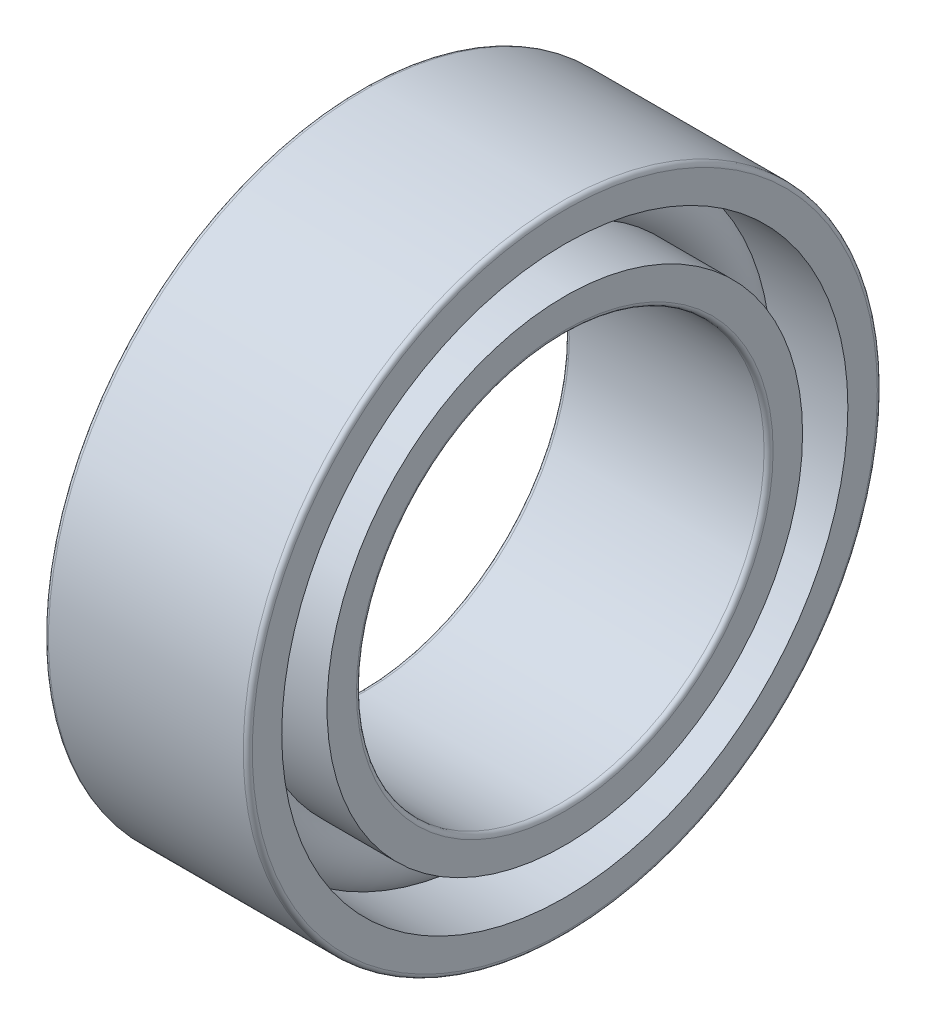
from build123d import *

# Parameters (mm, degrees)
CAGSPISKE_W     = 0.15
CAGSPISKE_H     = 0.25
CAGESPINE_ANGLE = 0.001
BALSIMSKE_R     = 0.75


with BuildPart() as part:
    # CagSpiSke → CageSpine (revolve)
    with BuildSketch(Plane.XY):
        with Locations((0, 5.75)):
            Rectangle(CAGSPISKE_W, CAGSPISKE_H)
    revolve(axis=Axis((-20.6375, 0, 0), (-1, 0, 0)), revolution_arc=CAGESPINE_ANGLE)

    # BalSimSke → BallsSimplified (revolve)
    with BuildSketch(Plane.XY):
        with Locations((0, 5.75)):
            Circle(BALSIMSKE_R)
    revolve(axis=Axis((-10, 0, 0), (1, 0, 0)))

    # InnRacSke → InnerRace (revolve)
    with BuildSketch(Plane.XY):
        with BuildLine():
            Line((-0.525, 5.25), (-2.25, 5.25))
            Line((-2.25, 5.25), (-2.25, 4.6))
            ThreePointArc((-2.25, 4.6), (-2.220710678, 4.529289322), (-2.15, 4.5))
            Line((-2.15, 4.5), (2.15, 4.5))
            ThreePointArc((2.15, 4.5), (2.220710678, 4.529289322), (2.25, 4.6))
            Line((2.25, 4.6), (2.25, 5.25))
            Line((2.25, 5.25), (0.525, 5.25))
            ThreePointArc((0.525, 5.25), (0, 5.025), (-0.525, 5.25))
        make_face()
    revolve(axis=Axis((-20.6375, 0, 0), (1, 0, 0)))

    # OutRacSke → OuterRace (revolve)
    with BuildSketch(Plane.XY):
        with BuildLine():
            Line((-0.525, 6.25), (-2.25, 6.25))
            Line((-2.25, 6.25), (-2.25, 6.9))
            ThreePointArc((-2.25, 6.9), (-2.220710678, 6.970710678), (-2.15, 7))
            Line((-2.15, 7), (2.15, 7))
            ThreePointArc((2.15, 7), (2.220710678, 6.970710678), (2.25, 6.9))
            Line((2.25, 6.9), (2.25, 6.25))
            Line((2.25, 6.25), (0.525, 6.25))
            ThreePointArc((0.525, 6.25), (0, 6.475), (-0.525, 6.25))
        make_face()
    revolve(axis=Axis((-20.6375, 0, 0), (1, 0, 0)))


solid = part.part
